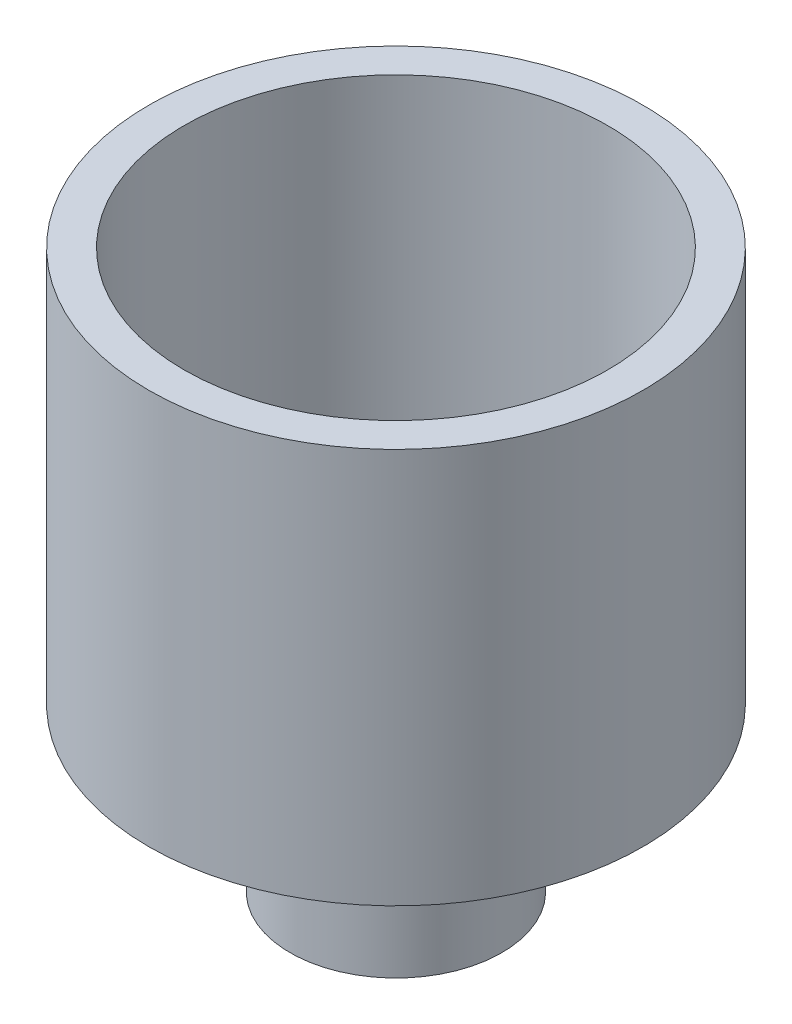
from build123d import *

# Parameters (mm, degrees)
SKETCH1_R           = 35
BOSS_EXTRUDE1_DEPTH = 56
SKETCH2_R           = 30
CUT_EXTRUDE1_DEPTH  = 46.9
SKETCH3_R           = 19.5
BOSS_EXTRUDE2_DEPTH = 7
SKETCH4_R           = 15
BOSS_EXTRUDE3_DEPTH = 16
FILLET1_R           = 5


with BuildPart() as part:
    # Sketch1 → Boss-Extrude1 (new body)
    with BuildSketch(Plane(origin=(0, 0, 0), x_dir=(1, 0, 0), z_dir=(0, 1, 0))):
        Circle(SKETCH1_R)
    extrude(amount=BOSS_EXTRUDE1_DEPTH)

    # Sketch2 → Cut-Extrude1 (cut)
    with BuildSketch(Plane(origin=(0, 56, 0), x_dir=(1, 0, 0), z_dir=(0, 1, 0))):
        Circle(SKETCH2_R)
    extrude(amount=-CUT_EXTRUDE1_DEPTH, mode=Mode.SUBTRACT)

    # Sketch3 → Boss-Extrude2 (add)
    with BuildSketch(Plane.XZ):
        Circle(SKETCH3_R)
    extrude(amount=BOSS_EXTRUDE2_DEPTH)

    # Sketch4 → Boss-Extrude3 (add)
    with BuildSketch(Plane.XZ.offset(7)):
        Circle(SKETCH4_R)
    extrude(amount=BOSS_EXTRUDE3_DEPTH)

    # Fillet1
    fillet1_edges = [part.edges().sort_by_distance(p)[0] for p in [
        (-19.5, 0, 0),
    ]]
    fillet(fillet1_edges, radius=FILLET1_R)


solid = part.part
